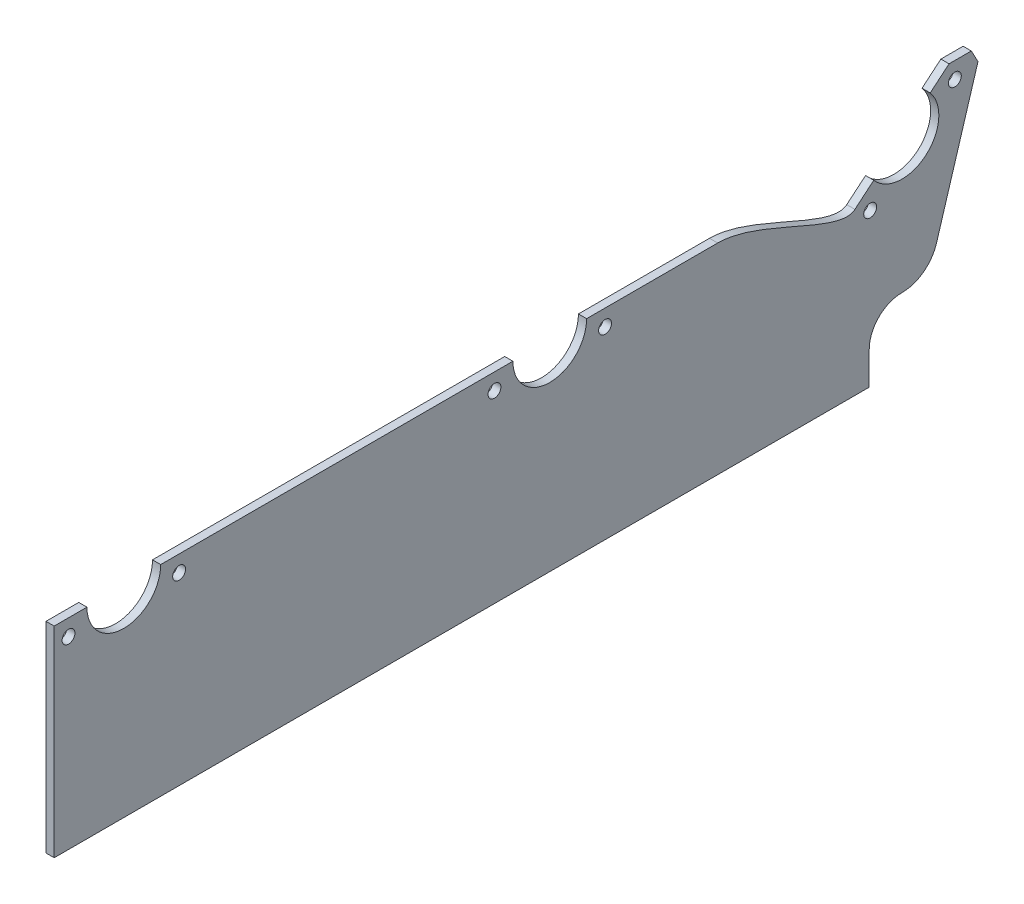
from build123d import *

# Parameters (mm, degrees)
BOSS_EXTRUDE1_DEPTH    = 3.175
F_10_CLEARANCE_HOLE1_D = 4.9784
CHAMFER1_SIZE          = 5.08
CHAMFER1_SIZE2         = 4.071417492


with BuildPart() as part:
    # Sketch1 → Boss-Extrude1 (new body)
    with BuildSketch(Plane(origin=(0, 0, 0), x_dir=(0, 0, -1), z_dir=(1, 0, 0))):
        with BuildLine():
            Line((-12.7, -12.7), (-328.6125, -12.7))
            Line((-328.6125, -12.7), (-328.6125, 65.0875))
            Line((-328.6125, 65.0875), (-315.9125, 65.0875))
            ThreePointArc((-315.9125, 65.0875), (-301.625, 50.8), (-287.3375, 65.0875))
            Line((-287.3375, 65.0875), (-150.8125, 65.0875))
            ThreePointArc((-150.8125, 65.0875), (-136.525, 50.8), (-122.2375, 65.0875))
            Line((-122.2375, 65.0875), (-71.4375, 65.0875))
            add(Edge.make_bspline(
                [(-18.243165022, 49.779666959), (-24.729007974, 44.33739853), (-54.504166667, 65.0875), (-71.4375, 65.0875)],
                knots=[0, 0, 0, 0, 1, 1, 1, 1], degree=3))
            Line((-18.243165022, 49.779666959), (-10.944859981, 55.903672027))
            ThreePointArc((-10.944859981, 55.903672027), (9.183827973, 54.142640019), (10.944859981, 74.271327973))
            Line((10.944859981, 74.271327973), (18.243165022, 80.395333041))
            Line((18.243165022, 80.395333041), (30.943165022, 80.395333041))
            Line((30.943165022, 80.395333041), (13.365423244, 22.604737215))
            ThreePointArc((13.365423244, 22.604737215), (8.317727421, 15.446083101), (0, 12.7))
            ThreePointArc((0, 12.7), (-8.980256121, 8.980256121), (-12.7, 0))
            Line((-12.7, 0), (-12.7, -12.7))
        make_face()
    extrude(amount=BOSS_EXTRUDE1_DEPTH)

    # #10 Clearance Hole1 (through all)
    with Locations(Plane(origin=(3.175, 0, 0), x_dir=(0, 0, -1), z_dir=(1, 0, 0))):
        with Locations((-323.05625, 58.7375), (-280.19375, 58.7375), (-157.95625, 58.7375), (-115.09375, 58.7375), (-12.33558865, 46.447375826), (20.498991293, 73.998859746)):
            Hole(F_10_CLEARANCE_HOLE1_D / 2)

    # Chamfer1
    chamfer1_edges = [part.edges().sort_by_distance(p)[0] for p in [
        (1.5875, 80.395333041, -30.943165022),
    ]]
    chamfer1_side = [part.faces().sort_by_distance(p)[0] for p in [
        (1.5875, 51.500035128, -22.154294133),
    ]]
    chamfer(chamfer1_edges, length=CHAMFER1_SIZE, length2=CHAMFER1_SIZE2, reference=chamfer1_side[0])


solid = part.part
